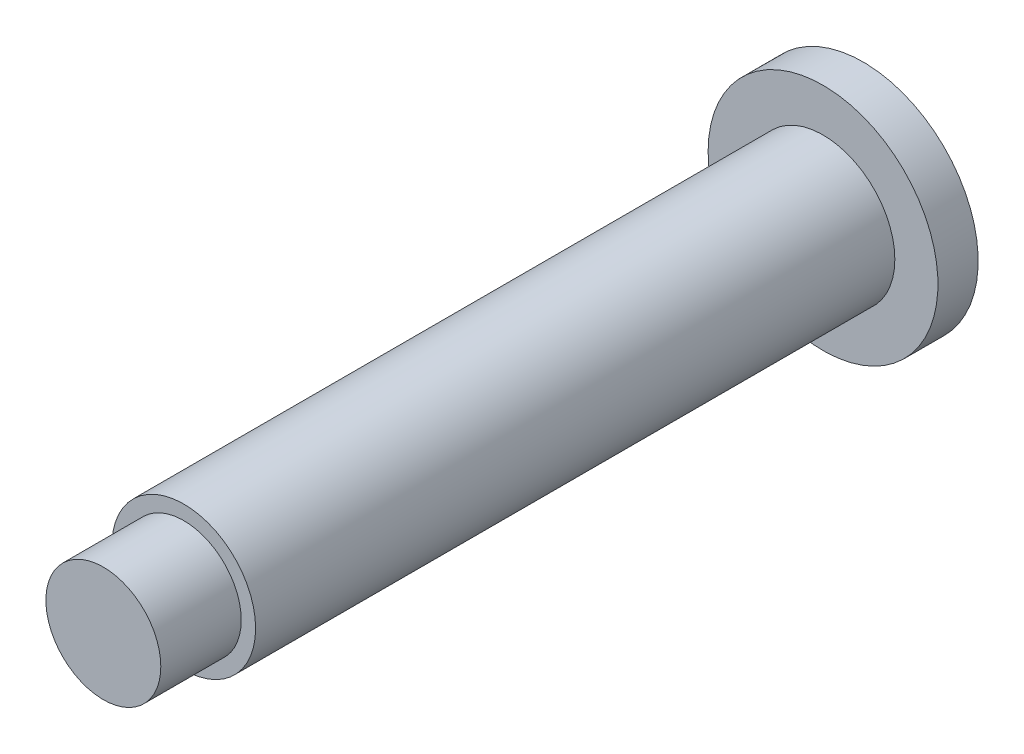
from build123d import *

# Parameters (mm, degrees)
SKETCH1_R           = 2.5
BOSS_EXTRUDE1_DEPTH = 22.25
SKETCH2_R           = 4
BOSS_EXTRUDE2_DEPTH = 1.4
SKETCH3_R           = 2.05
CUT_EXTRUDE1_DEPTH  = 3
SKETCH4_R           = 2
BOSS_EXTRUDE3_DEPTH = 2.8


with BuildPart() as part:
    # Sketch1 → Boss-Extrude1 (new body)
    with BuildSketch(Plane(origin=(0, 0, 0), x_dir=(0, 1, 0), z_dir=(0, 0, 1))):
        Circle(SKETCH1_R)
    extrude(amount=BOSS_EXTRUDE1_DEPTH)

    # Sketch2 → Boss-Extrude2 (add)
    with BuildSketch(Plane(origin=(0, 0, 0), x_dir=(1, 0, 0), z_dir=(0, 0, -1))):
        Circle(SKETCH2_R)
    extrude(amount=BOSS_EXTRUDE2_DEPTH)

    # Sketch3 → Cut-Extrude1 (cut)
    with BuildSketch(Plane(origin=(0, 0, -1.4), x_dir=(1, 0, 0), z_dir=(0, 0, -1))):
        Circle(SKETCH3_R)
    extrude(amount=-CUT_EXTRUDE1_DEPTH, mode=Mode.SUBTRACT)

    # Sketch4 → Boss-Extrude3 (add)
    with BuildSketch(Plane.XY.offset(22.25)):
        Circle(SKETCH4_R)
    extrude(amount=BOSS_EXTRUDE3_DEPTH)


solid = part.part
